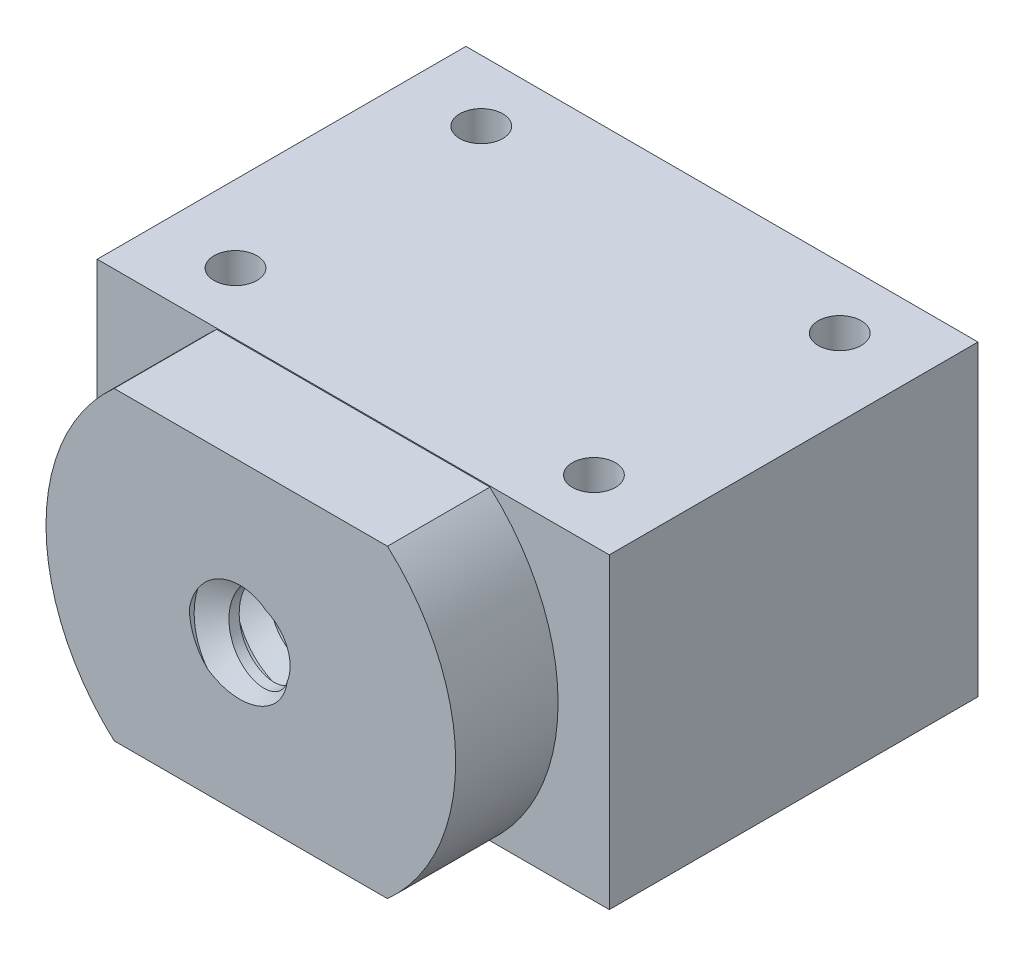
from build123d import *

# Parameters (mm, degrees)
SKETCH1_W             = 50
SKETCH1_H             = 30
SKETCH1_R             = 6
BOSS_EXTRUDE1_DEPTH   = 36
M5_TAPPED_HOLE2_D     = 4.2
M5_TAPPED_HOLE2_DEPTH = 10
M5_TAPPED_HOLE2_TIP   = 1.2618073
SKETCH6_R             = 6
BOSS_EXTRUDE3_DEPTH   = 10
SKETCH8_R             = 11
CUT_EXTRUDE1_DEPTH    = 6
THREAD1_PITCH         = 4
THREAD1_FROM          = 6
THREAD1_TO            = 46


with BuildPart() as part:
    # Sketch1 → Boss-Extrude1 (new body)
    with BuildSketch(Plane.XY):
        Rectangle(SKETCH1_W, SKETCH1_H)
        Circle(SKETCH1_R, mode=Mode.SUBTRACT)
    extrude(amount=BOSS_EXTRUDE1_DEPTH)

    # M5 Tapped Hole2
    with Locations(Plane(origin=(0, 15, 0), x_dir=(1, 0, 0), z_dir=(0, 1, 0))):
        with Locations((-17.5, -6), (17.5, -6), (17.5, -30), (-17.5, -30)):
            Hole(M5_TAPPED_HOLE2_D / 2, depth=M5_TAPPED_HOLE2_DEPTH)
            with Locations((0, 0, -(M5_TAPPED_HOLE2_DEPTH + M5_TAPPED_HOLE2_TIP / 2))):  # 118° drill point
                Cone(0, M5_TAPPED_HOLE2_D / 2, M5_TAPPED_HOLE2_TIP, mode=Mode.SUBTRACT)

    # Sketch6 → Boss-Extrude3 (add)
    with BuildSketch(Plane.XY.offset(36)):
        with BuildLine():
            Line((-13.341289293, -14.9), (13.341289293, -14.9))
            ThreePointArc((13.341289293, -14.9), (20, 0), (13.341289293, 14.9))
            Line((13.341289293, 14.9), (-13.341289293, 14.9))
            ThreePointArc((-13.341289293, 14.9), (-20, 0), (-13.341289293, -14.9))
        make_face()
        Circle(SKETCH6_R, mode=Mode.SUBTRACT)
    extrude(amount=BOSS_EXTRUDE3_DEPTH)

    # Sketch8 → Cut-Extrude1 (cut)
    with BuildSketch(Plane(origin=(0, 0, 0), x_dir=(-1, 0, 0), z_dir=(0, 0, -1))):
        Circle(SKETCH8_R)
    extrude(amount=-CUT_EXTRUDE1_DEPTH, mode=Mode.SUBTRACT)

    # Thread1: arcs per turn and ends read off the stored shape
    # Thread1: the profile of Thread Profile2 profile screwed along a right-hand helix through 11.5 turns, 12 arcs to a turn; built about Z, then put on its axis
    thread1_z = Axis((0, 0, 0), (0, 0, 1))
    thread1_corners = [(6.0003, 0, -0.000173205), (6.0003, 0, 3.500173194), (3.8349365, 0, 2.249999995), (3.8349365, 0, 1.249999995)]
    with BuildLine(mode=Mode.PRIVATE) as thread1_profile:
        Line(thread1_corners[0], thread1_corners[1])
        Line(thread1_corners[1], thread1_corners[2])
        Line(thread1_corners[2], thread1_corners[3])
        Line(thread1_corners[3], thread1_corners[0])
    thread1_cap = Face(thread1_profile.wire())
    thread1_turn_angles = [0, 15, 30, 45, 60, 75, 90, 105, 120, 135, 150, 165, 180, 195, 210, 225, 240, 255, 270, 285, 300, 315, 330, 345, 360]
    thread1_turn_weights = [1, 0.9659258262890683, 1, 0.9659258262890683, 1, 0.9659258262890683, 1, 0.9659258262890683, 1, 0.9659258262890683, 1, 0.9659258262890683, 1, 0.9659258262890683, 1, 0.9659258262890683, 1, 0.9659258262890683, 1, 0.9659258262890683, 1, 0.9659258262890683, 1, 0.9659258262890683, 1]
    thread1_turn_rails = [Edge.make_bspline([Vector(p[0], p[1], 0).rotate(thread1_z, thread1_turn_angles[k]) / thread1_turn_weights[k] + Vector(0, 0, p[2] + THREAD1_PITCH * thread1_turn_angles[k] / 360) for k in range(25)], [0, 0, 0, 1, 1, 2, 2, 3, 3, 4, 4, 5, 5, 6, 6, 7, 7, 8, 8, 9, 9, 10, 10, 11, 11, 12, 12, 12], 2, thread1_turn_weights) for p in thread1_corners]
    thread1_turn_sides = [Face.make_surface_from_curves(thread1_turn_rails[p[0]], thread1_turn_rails[p[1]]) for p in [(0, 1), (1, 2), (2, 3), (3, 0)]]
    thread1_last_angles = [3960, 3975, 3990, 4005, 4020, 4035, 4050, 4065, 4080, 4095, 4110, 4125, 4140]
    thread1_last_weights = [1, 0.9659258262890683, 1, 0.9659258262890683, 1, 0.9659258262890683, 1, 0.9659258262890683, 1, 0.9659258262890683, 1, 0.9659258262890683, 1]
    thread1_last_rails = [Edge.make_bspline([Vector(p[0], p[1], 0).rotate(thread1_z, thread1_last_angles[k]) / thread1_last_weights[k] + Vector(0, 0, p[2] + THREAD1_PITCH * thread1_last_angles[k] / 360) for k in range(13)], [0, 0, 0, 1, 1, 2, 2, 3, 3, 4, 4, 5, 5, 6, 6, 6], 2, thread1_last_weights) for p in thread1_corners]
    thread1_last_sides = [Face.make_surface_from_curves(thread1_last_rails[p[0]], thread1_last_rails[p[1]]) for p in [(0, 1), (1, 2), (2, 3), (3, 0)]]
    thread1 = Plane(origin=(0, 0, 0), x_dir=(1, 0, 0), z_dir=(0, 0, 1)) * split(split(Solid(Shell([*[p.moved(Location((0, 0, THREAD1_PITCH * i))) for i in range(11) for p in thread1_turn_sides], *thread1_last_sides, thread1_cap, thread1_cap.rotate(thread1_z, 4140).moved(Location((0, 0, THREAD1_PITCH * 4140 / 360)))])), bisect_by=Plane.XY.offset(THREAD1_FROM), keep=Keep.TOP, mode=Mode.PRIVATE), bisect_by=Plane.XY.offset(THREAD1_TO), keep=Keep.BOTTOM, mode=Mode.PRIVATE)
    add(thread1)


solid = part.part
